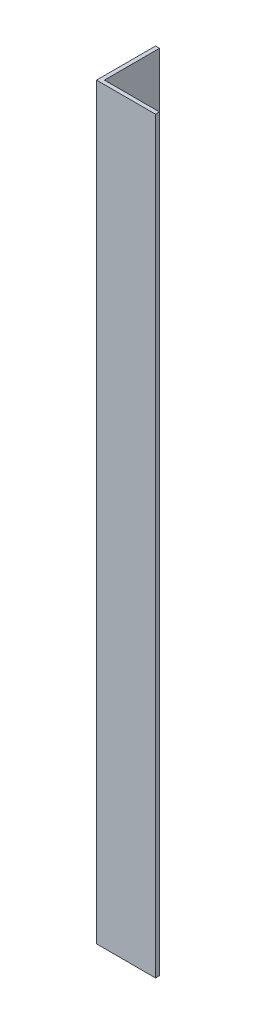
from build123d import *

# Parameters (mm, degrees)
EXTRUDE_1_DEPTH     = 190
SKETCH_2_R          = 2.25
CUT_EXTRUDE_1_DEPTH = 192.104683354


with BuildPart() as part:
    # Эскиз1 → Бобышка-Вытянуть1 (new body)
    with BuildSketch(Plane(origin=(0, 0, 0), x_dir=(1, 0, 0), z_dir=(0, 1, 0))):
        Polygon((0, 0), (0, 15), (1, 15), (1, 1), (15, 1), (15, 0), align=None)
    extrude(amount=EXTRUDE_1_DEPTH)

    # Эскиз2 → Вырез-Вытянуть1 (cut, through all)
    with BuildSketch(Plane(origin=(1, 0, 0), x_dir=(0, 0, -1), z_dir=(1, 0, 0))):
        with Locations((8, 179.5)):
            Circle(SKETCH_2_R)
    extrude(amount=-CUT_EXTRUDE_1_DEPTH, mode=Mode.SUBTRACT)


solid = part.part
